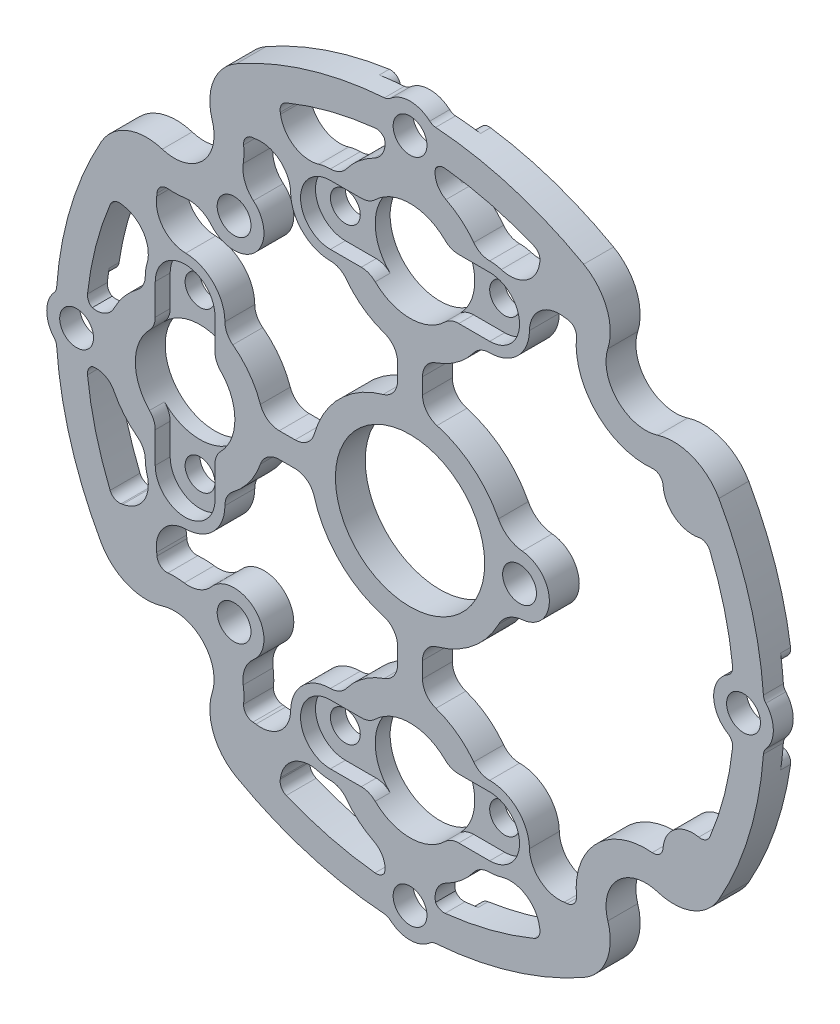
from build123d import *

# Parameters (mm, degrees)
SKETCH_3_R                     = 3
EXTRUDE_2_DEPTH                = 3
EXTRUDE_2_2_DEPTH              = 3
EXTRUDE_2_3_DEPTH              = 3
EXTRUDE_2_4_DEPTH              = 3
EXTRUDE_2_5_DEPTH              = 3
EXTRUDE_2_6_DEPTH              = 3
EXTRUDE_2_7_DEPTH              = 3
EXTRUDE_2_8_DEPTH              = 3
EXTRUDE_2_9_DEPTH              = 3
EXTRUDE_2_10_DEPTH             = 3
EXTRUDE_2_11_DEPTH             = 3
EXTRUDE_2_12_DEPTH             = 3
EXTRUDE_3_DEPTH                = 3
HOLE_WIZARD_M3_1_D             = 3.4
EXTRUDE_4_DEPTH                = 3
FILLET_1_R                     = 1
SKETCH_11_R                    = 5
SKETCH_11_R_2                  = 1.5
EXTRUDE_5_DEPTH                = 3
EXTRUDE_6_DEPTH                = 3
FILLET_2_R                     = 2
PATTERN_CIRCULAR_2_OUTLINE_R   = 1.5
PATTERN_CIRCULAR_2_OUTLINE_R_2 = 5
PATTERN_CIRCULAR_2_DEPTH       = 3
FILLET_3_R                     = 2
CUT_EXTRUDE_1_DEPTH            = 1.5
FILLET_4_R                     = 2
SKETCH_14_R                    = 4
CUT_EXTRUDE_2_DEPTH            = 1
FILLET_5_R                     = 1
SKETCH_16_R                    = 10
SKETCH_16_R_2                  = 7.5
EXTRUDE_7_DEPTH                = 3
SKETCH_17_W                    = 2.5
SKETCH_17_H                    = 7.678432584
SKETCH_17_W_2                  = 7.678432584
SKETCH_17_H_2                  = 2.5
EXTRUDE_8_DEPTH                = 3
FILLET_6_R                     = 2
SKETCH_18_R                    = 3
EXTRUDE_9_DEPTH                = 3
FILLET_7_R                     = 3
SKETCH_21_R                    = 3
EXTRUDE_10_DEPTH               = 3
FILLET_8_R                     = 3
HOLE_WIZARD_M3_2_D             = 3.4


with BuildPart() as part:
    # ｽｹｯﾁ3 → ﾎﾞｽ - 押し出し2 (new body)
    with BuildSketch(Plane.XY):
        with Locations((-15.974774553, 28.414342437)):
            Circle(SKETCH_3_R)
    extrude(amount=EXTRUDE_2_DEPTH)



with BuildPart() as body_2:
    # ｽｹｯﾁ3 → Extrude 2 2 (new body)
    with BuildSketch(Plane.XY):
        with Locations((0, 33.5)):
            Circle(SKETCH_3_R)
    extrude(amount=EXTRUDE_2_2_DEPTH)


with BuildPart() as body_3:
    # ｽｹｯﾁ3 → Extrude 2 3 (new body)
    with BuildSketch(Plane.XY):
        with Locations((15.974774553, 28.414342437)):
            Circle(SKETCH_3_R)
    extrude(amount=EXTRUDE_2_3_DEPTH)


with BuildPart() as body_4:
    # ｽｹｯﾁ3 → Extrude 2 4 (new body)
    with BuildSketch(Plane.XY):
        with Locations((28.414342437, 15.974774553)):
            Circle(SKETCH_3_R)
    extrude(amount=EXTRUDE_2_4_DEPTH)


with BuildPart() as body_5:
    # ｽｹｯﾁ3 → Extrude 2 5 (new body)
    with BuildSketch(Plane.XY):
        with Locations((33.5, 0)):
            Circle(SKETCH_3_R)
    extrude(amount=EXTRUDE_2_5_DEPTH)


with BuildPart() as body_6:
    # ｽｹｯﾁ3 → Extrude 2 6 (new body)
    with BuildSketch(Plane.XY):
        with Locations((28.414342437, -15.974774553)):
            Circle(SKETCH_3_R)
    extrude(amount=EXTRUDE_2_6_DEPTH)


with BuildPart() as body_7:
    # ｽｹｯﾁ3 → Extrude 2 7 (new body)
    with BuildSketch(Plane.XY):
        with Locations((15.974774553, -28.414342437)):
            Circle(SKETCH_3_R)
    extrude(amount=EXTRUDE_2_7_DEPTH)


with BuildPart() as body_8:
    # ｽｹｯﾁ3 → Extrude 2 8 (new body)
    with BuildSketch(Plane.XY):
        with Locations((0, -33.5)):
            Circle(SKETCH_3_R)
    extrude(amount=EXTRUDE_2_8_DEPTH)


with BuildPart() as body_9:
    # ｽｹｯﾁ3 → Extrude 2 9 (new body)
    with BuildSketch(Plane.XY):
        with Locations((-15.974774553, -28.414342437)):
            Circle(SKETCH_3_R)
    extrude(amount=EXTRUDE_2_9_DEPTH)


with BuildPart() as body_10:
    # ｽｹｯﾁ3 → Extrude 2 10 (new body)
    with BuildSketch(Plane.XY):
        with Locations((-28.414342437, -15.974774553)):
            Circle(SKETCH_3_R)
    extrude(amount=EXTRUDE_2_10_DEPTH)


with BuildPart() as body_11:
    # ｽｹｯﾁ3 → Extrude 2 11 (new body)
    with BuildSketch(Plane.XY):
        with Locations((-33.5, 0)):
            Circle(SKETCH_3_R)
    extrude(amount=EXTRUDE_2_11_DEPTH)


with BuildPart() as body_12:
    # ｽｹｯﾁ3 → Extrude 2 12 (new body)
    with BuildSketch(Plane.XY):
        with Locations((-28.414342437, 15.974774553)):
            Circle(SKETCH_3_R)
    extrude(amount=EXTRUDE_2_12_DEPTH)


with BuildPart() as part_1:
    add(part.part)

    add(body_2.part)  # ﾎﾞｽ - 押し出し3 merges body 2

    add(body_3.part)  # ﾎﾞｽ - 押し出し3 merges body 3

    add(body_4.part)  # ﾎﾞｽ - 押し出し3 merges body 4

    add(body_5.part)  # ﾎﾞｽ - 押し出し3 merges body 5

    add(body_6.part)  # ﾎﾞｽ - 押し出し3 merges body 6

    add(body_7.part)  # ﾎﾞｽ - 押し出し3 merges body 7

    add(body_8.part)  # ﾎﾞｽ - 押し出し3 merges body 8

    add(body_9.part)  # ﾎﾞｽ - 押し出し3 merges body 9

    add(body_10.part)  # ﾎﾞｽ - 押し出し3 merges body 10

    add(body_11.part)  # ﾎﾞｽ - 押し出し3 merges body 11

    add(body_12.part)  # ﾎﾞｽ - 押し出し3 merges body 12
    # ｽｹｯﾁ4 → ﾎﾞｽ - 押し出し3 (add, through all)
    with BuildSketch(Plane.XY):
        with BuildLine():
            ThreePointArc((17.44497845, 31.029395114), (0, 35.597059348), (-17.44497845, 31.029395114))
            ThreePointArc((-17.44497845, 31.029395114), (-15.098976916, 31.283659167), (-13.294838524, 29.762653557))
            ThreePointArc((-13.294838524, 29.762653557), (0, 32.597059348), (13.294838524, 29.762653557))
            ThreePointArc((13.294838524, 29.762653557), (15.098976916, 31.283659167), (17.44497845, 31.029395114))
        make_face()
        with BuildLine():
            ThreePointArc((31.029395114, -17.44497845), (35.597059348, 0), (31.029395114, 17.44497845))
            ThreePointArc((31.029395114, 17.44497845), (31.283659167, 15.098976916), (29.762653557, 13.294838524))
            ThreePointArc((29.762653557, 13.294838524), (32.597059348, 0), (29.762653557, -13.294838524))
            ThreePointArc((29.762653557, -13.294838524), (31.283659167, -15.098976916), (31.029395114, -17.44497845))
        make_face()
        with BuildLine():
            ThreePointArc((-17.44497845, -31.029395114), (0, -35.597059348), (17.44497845, -31.029395114))
            ThreePointArc((17.44497845, -31.029395114), (15.098976916, -31.283659167), (13.294838524, -29.762653557))
            ThreePointArc((13.294838524, -29.762653557), (0, -32.597059348), (-13.294838524, -29.762653557))
            ThreePointArc((-13.294838524, -29.762653557), (-15.098976916, -31.283659167), (-17.44497845, -31.029395114))
        make_face()
        with BuildLine():
            ThreePointArc((-31.029395114, 17.44497845), (-35.597059348, 0), (-31.029395114, -17.44497845))
            ThreePointArc((-31.029395114, -17.44497845), (-31.283659167, -15.098976916), (-29.762653557, -13.294838524))
            ThreePointArc((-29.762653557, -13.294838524), (-32.597059348, 0), (-29.762653557, 13.294838524))
            ThreePointArc((-29.762653557, 13.294838524), (-31.283659167, 15.098976916), (-31.029395114, 17.44497845))
        make_face()
    extrude(amount=EXTRUDE_3_DEPTH)

    # M3 すきま穴1 (through all)
    with Locations(Plane.XY.offset(3)):
        with Locations((-33.5, 0), (0, 33.5), (33.5, 0), (0, -33.5)):
            Hole(HOLE_WIZARD_M3_1_D / 2)

    # ｽｹｯﾁ10 → ﾎﾞｽ - 押し出し4 (add, through all)
    with BuildSketch(Plane.XY.offset(3)):
        with BuildLine():
            ThreePointArc((-19.873090279, 24.890522605), (-19.802755968, 22.737141232), (-20.859650045, 20.859650045))
            ThreePointArc((-20.859650045, 20.859650045), (-22.737141232, 19.802755968), (-24.890522605, 19.873090279))
            ThreePointArc((-24.890522605, 19.873090279), (-28.390768746, 19.748229243), (-31.029395114, 17.44497845))
            ThreePointArc((-31.029395114, 17.44497845), (-28.14183504, 18.962372203), (-25.576454012, 16.947599968))
            ThreePointArc((-25.576454012, 16.947599968), (-18.738329701, 18.738329701), (-16.947599968, 25.576454012))
            ThreePointArc((-16.947599968, 25.576454012), (-18.962372203, 28.14183504), (-17.44497845, 31.029395114))
            ThreePointArc((-17.44497845, 31.029395114), (-19.748229243, 28.390768746), (-19.873090279, 24.890522605))
        make_face()
        with BuildLine():
            ThreePointArc((24.890522605, 19.873090279), (22.737141232, 19.802755968), (20.859650045, 20.859650045))
            ThreePointArc((20.859650045, 20.859650045), (19.802755968, 22.737141232), (19.873090279, 24.890522605))
            ThreePointArc((19.873090279, 24.890522605), (19.748229243, 28.390768746), (17.44497845, 31.029395114))
            ThreePointArc((17.44497845, 31.029395114), (18.962372203, 28.14183504), (16.947599968, 25.576454012))
            ThreePointArc((16.947599968, 25.576454012), (18.738329701, 18.738329701), (25.576454012, 16.947599968))
            ThreePointArc((25.576454012, 16.947599968), (28.14183504, 18.962372203), (31.029395114, 17.44497845))
            ThreePointArc((31.029395114, 17.44497845), (28.390768746, 19.748229243), (24.890522605, 19.873090279))
        make_face()
        with BuildLine():
            ThreePointArc((19.873090279, -24.890522605), (19.802755968, -22.737141232), (20.859650045, -20.859650045))
            ThreePointArc((20.859650045, -20.859650045), (22.737141232, -19.802755968), (24.890522605, -19.873090279))
            ThreePointArc((24.890522605, -19.873090279), (28.390768746, -19.748229243), (31.029395114, -17.44497845))
            ThreePointArc((31.029395114, -17.44497845), (28.14183504, -18.962372203), (25.576454012, -16.947599968))
            ThreePointArc((25.576454012, -16.947599968), (18.738329701, -18.738329701), (16.947599968, -25.576454012))
            ThreePointArc((16.947599968, -25.576454012), (18.962372203, -28.14183504), (17.44497845, -31.029395114))
            ThreePointArc((17.44497845, -31.029395114), (19.748229243, -28.390768746), (19.873090279, -24.890522605))
        make_face()
        with BuildLine():
            ThreePointArc((-24.890522605, -19.873090279), (-22.737141232, -19.802755968), (-20.859650045, -20.859650045))
            ThreePointArc((-20.859650045, -20.859650045), (-19.802755968, -22.737141232), (-19.873090279, -24.890522605))
            ThreePointArc((-19.873090279, -24.890522605), (-19.748229243, -28.390768746), (-17.44497845, -31.029395114))
            ThreePointArc((-17.44497845, -31.029395114), (-18.962372203, -28.14183504), (-16.947599968, -25.576454012))
            ThreePointArc((-16.947599968, -25.576454012), (-18.738329701, -18.738329701), (-25.576454012, -16.947599968))
            ThreePointArc((-25.576454012, -16.947599968), (-28.14183504, -18.962372203), (-31.029395114, -17.44497845))
            ThreePointArc((-31.029395114, -17.44497845), (-28.390768746, -19.748229243), (-24.890522605, -19.873090279))
        make_face()
    extrude(amount=-EXTRUDE_4_DEPTH)

    # ﾌｨﾚｯﾄ1
    fillet_1_edges = [part_1.edges().sort_by_distance(p)[0] for p in [
        (16.947599968, -25.576454012, 1.5),
        (25.576454012, -16.947599968, 1.5),
        (13.294838524, -29.762653557, 1.5),
        (-2.819427126, -32.474899674, 1.5),
        (2.819427126, -32.474899674, 1.5),
        (-2.21036752, -35.528367675, 1.5),
        (2.21036752, -35.528367675, 1.5),
        (-13.294838524, -29.762653557, 1.5),
        (-25.576454012, -16.947599968, 1.5),
        (-16.947599968, -25.576454012, 1.5),
        (-2.819427126, 32.474899674, 1.5),
        (2.819427126, 32.474899674, 1.5),
        (2.21036752, 35.528367675, 1.5),
        (-2.21036752, 35.528367675, 1.5),
        (-16.947599968, 25.576454012, 1.5),
        (-25.576454012, 16.947599968, 1.5),
        (-29.762653557, -13.294838524, 1.5),
        (-32.474899674, 2.819427126, 1.5),
        (-32.474899674, -2.819427126, 1.5),
        (-35.528367675, 2.21036752, 1.5),
        (-35.528367675, -2.21036752, 1.5),
        (-29.762653557, 13.294838524, 1.5),
        (13.294838524, 29.762653557, 1.5),
        (25.576454012, 16.947599968, 1.5),
        (16.947599968, 25.576454012, 1.5),
        (-13.294838524, 29.762653557, 1.5),
        (29.762653557, 13.294838524, 1.5),
        (32.474899674, -2.819427126, 1.5),
        (32.474899674, 2.819427126, 1.5),
        (35.528367675, -2.21036752, 1.5),
        (35.528367675, 2.21036752, 1.5),
        (29.762653557, -13.294838524, 1.5),
    ]]
    fillet(fillet_1_edges, radius=FILLET_1_R)

    # ｽｹｯﾁ11 → ﾎﾞｽ - 押し出し5 (add)
    with BuildSketch(Plane.XY.offset(3)):
        with BuildLine():
            ThreePointArc((7, 26.472983346), (0, 30.6), (-7, 26.472983346))
            ThreePointArc((-7, 26.472983346), (-12, 22.6), (-7, 18.727016654))
            ThreePointArc((-7, 18.727016654), (0, 14.6), (7, 18.727016654))
            ThreePointArc((7, 18.727016654), (12, 22.6), (7, 26.472983346))
        make_face()
        with Locations((0, 22.6)):
            Circle(SKETCH_11_R, mode=Mode.SUBTRACT)
        with Locations((8, 22.6)):
            Circle(SKETCH_11_R_2, mode=Mode.SUBTRACT)
        with Locations((-8, 22.6)):
            Circle(SKETCH_11_R_2, mode=Mode.SUBTRACT)
    extrude(amount=-EXTRUDE_5_DEPTH)

    # ｽｹｯﾁ12 → ﾎﾞｽ - 押し出し6 (add)
    with BuildSketch(Plane.XY.offset(3)):
        with BuildLine():
            ThreePointArc((-11.999542968, 22.53953474), (-13.075327897, 24.796079663), (-15.486987374, 25.454264115))
            ThreePointArc((-15.486987374, 25.454264115), (-13.550665526, 26.646944512), (-13.007352228, 28.855255969))
            ThreePointArc((-13.007352228, 28.855255969), (-11.643112099, 26.760463121), (-9.16567423, 26.426382572))
            ThreePointArc((-9.16567423, 26.426382572), (-11.23214537, 24.956530565), (-11.999542968, 22.53953474))
        make_face()
        with BuildLine():
            ThreePointArc((9.16567423, 26.426382572), (11.23214537, 24.956530565), (11.999542968, 22.53953474))
            ThreePointArc((11.999542968, 22.53953474), (13.075327897, 24.796079663), (15.486987374, 25.454264115))
            ThreePointArc((15.486987374, 25.454264115), (13.550665526, 26.646944512), (13.007352228, 28.855255969))
            ThreePointArc((13.007352228, 28.855255969), (11.643112099, 26.760463121), (9.16567423, 26.426382572))
        make_face()
    extrude(amount=-EXTRUDE_6_DEPTH)

    # ﾌｨﾚｯﾄ2
    # the kernel refuses this fillet: 2 mm, written as the material it adds along each edge
    with BuildSketch(Plane(origin=(7, 26.472983346, 3), x_dir=(0.9920296962671665, 0.12600429248272882, 0), z_dir=(0, 0, -1)), Plane(origin=(-7, 18.727016654, 3), x_dir=(-0.9920296962671661, -0.1260042924827324, 0), z_dir=(0, 0, -1))) as fillet_2_piece_1:
        with BuildLine():
            CenterArc((1.260042925, -1.984059393), FILLET_2_R, 97.238756093, 53.130102354)
            Line((-0.47840974, -0.995230625), (-0.513178793, -0.97545405))
            ThreePointArc((-0.513178793, -0.97545405), (-0.258063853, -0.488549754), (-0.037161102, 0.014800422))
            Line((-0.037161102, 0.014800422), (0.005040172, 0.039681188))
            ThreePointArc((0.005040172, 0.039681188), (0.50401717, 0.008118785), (1.002994168, 0.039681188))
            Line((1.002994168, 0.039681188), (1.00803434, 0))
        make_face()
    extrude(amount=3)
    with BuildSketch(Plane(origin=(-0.657491484, 30.57293578, 3), x_dir=(-0.8131085092475036, 0.5821121474332094, 0), z_dir=(0, 0, -1))) as fillet_2_piece_2:
        with BuildLine():
            CenterArc((3.690002082, -1.474292342), FILLET_2_R, 132.511122796, 75.042824498)
            Line((1.916850728, -2.399459503), (1.881387701, -2.417962846))
            ThreePointArc((1.881387701, -2.417962846), (1.043394604, -1.131850569), (-0.025878773, -0.030500641))
            Line((-0.025878773, -0.030500641), (0.015590236, 0.036836728))
            ThreePointArc((0.015590236, 0.036836728), (1.169267719, -0.197245396), (2.311506105, 0.029485847))
            Line((2.311506105, 0.029485847), (2.338535438, 0))
        make_face()
    extrude(amount=3)
    with BuildSketch(Plane(origin=(0.657491484, 30.57293578, 3), x_dir=(0.9623104427147063, -0.2719533265879019, 0), z_dir=(0, 0, -1))) as fillet_2_piece_3:
        with BuildLine():
            CenterArc((3.454999847, -1.962811589), FILLET_2_R, 101.066281051, 75.042824498)
            Line((1.459609696, -1.827098117), (1.419701893, -1.824383848))
            ThreePointArc((1.419701893, -1.824383848), (0.883912708, -0.790437265), (-0.01904981, -0.0351725))
            Line((-0.01904981, -0.0351725), (0.007677777, 0.039256232))
            ThreePointArc((0.007677777, 0.039256232), (1.535555487, -0.108753644), (3.063433197, 0.039256232))
            Line((3.063433197, 0.039256232), (3.071110975, 0))
        make_face()
    extrude(amount=3)
    with BuildSketch(Plane(origin=(7, 18.727016654, 3), x_dir=(-0.5433570423605241, -0.8395017120394833, 0), z_dir=(0, 0, -1)), Plane(origin=(-7, 26.472983346, 3), x_dir=(0.5433570423605201, 0.8395017120394861, 0), z_dir=(0, 0, -1))) as fillet_2_piece_4:
        with BuildLine():
            CenterArc((1.24227708, -1.99523119), FILLET_2_R, 93.957436637, 53.130102354)
            Line((-0.436726344, -0.908517105), (-0.470306413, -0.886782824))
            ThreePointArc((-0.470306413, -0.886782824), (-0.225680438, -0.450741126), (-0.037947332, 0.012649111))
            Line((-0.037947332, 0.012649111), (0.002760616, 0.039904624))
            ThreePointArc((0.002760616, 0.039904624), (0.552123147, 0.02092476), (1.101485678, 0.039904624))
            Line((1.101485678, 0.039904624), (1.104246293, 0))
        make_face()
    extrude(amount=3)

    # 円形ﾊﾟﾀｰﾝ2: read off the stored shape, not the designer's step
    # 円形ﾊﾟﾀｰﾝ2 outline → 円形ﾊﾟﾀｰﾝ2 (add)
    # profile 1 of 2: a face of its own
    with BuildSketch(Plane.XY):
        with BuildLine():
            ThreePointArc((-17.8, 6.4), (-18.388854382, 7.105572809), (-18.6, 8))
            ThreePointArc((-18.6, 8), (-19.750275361, 10.806968022), (-22.53953474, 11.999542968))
            ThreePointArc((-22.53953474, 11.999542968), (-24.796079663, 13.075327897), (-25.454264115, 15.486987374))
            ThreePointArc((-25.454264115, 15.486987374), (-26.646944512, 13.550665526), (-28.855255969, 13.007352228))
            ThreePointArc((-28.855255969, 13.007352228), (-26.760463121, 11.643112099), (-26.426382572, 9.16567423))
            ThreePointArc((-26.426382572, 9.16567423), (-26.55635756, 8.589266371), (-26.6, 8))
            ThreePointArc((-26.6, 8), (-26.811145618, 7.105572809), (-27.4, 6.4))
            ThreePointArc((-27.4, 6.4), (-29.602219157, 3.868969743), (-30.57293578, 0.657491484))
            ThreePointArc((-30.57293578, 0.657491484), (-30.5, 0), (-30.57293578, -0.657491484))
            ThreePointArc((-30.57293578, -0.657491484), (-29.602219157, -3.868969743), (-27.4, -6.4))
            ThreePointArc((-27.4, -6.4), (-26.811145618, -7.105572809), (-26.6, -8))
            ThreePointArc((-26.6, -8), (-26.55635756, -8.589266371), (-26.426382572, -9.16567423))
            ThreePointArc((-26.426382572, -9.16567423), (-26.760463121, -11.643112099), (-28.855255969, -13.007352228))
            ThreePointArc((-28.855255969, -13.007352228), (-26.646944512, -13.550665526), (-25.454264115, -15.486987374))
            ThreePointArc((-25.454264115, -15.486987374), (-24.796079663, -13.075327897), (-22.53953474, -11.999542968))
            ThreePointArc((-22.53953474, -11.999542968), (-19.750275361, -10.806968022), (-18.6, -8))
            ThreePointArc((-18.6, -8), (-18.388854382, -7.105572809), (-17.8, -6.4))
            ThreePointArc((-17.8, -6.4), (-14.6, 0), (-17.8, 6.4))
        make_face()
        with Locations((-22.6, -8)):
            Circle(PATTERN_CIRCULAR_2_OUTLINE_R, mode=Mode.SUBTRACT)
        with Locations((-22.6, 0)):
            Circle(PATTERN_CIRCULAR_2_OUTLINE_R_2, mode=Mode.SUBTRACT)
        with Locations((-22.6, 8)):
            Circle(PATTERN_CIRCULAR_2_OUTLINE_R, mode=Mode.SUBTRACT)
    # profile 2 of 2: a face of its own
    with BuildSketch(Plane.XY):
        with BuildLine():
            ThreePointArc((-6.4, -17.8), (-7.105572809, -18.388854382), (-8, -18.6))
            ThreePointArc((-8, -18.6), (-10.806968022, -19.750275361), (-11.999542968, -22.53953474))
            ThreePointArc((-11.999542968, -22.53953474), (-13.075327897, -24.796079663), (-15.486987374, -25.454264115))
            ThreePointArc((-15.486987374, -25.454264115), (-13.550665526, -26.646944512), (-13.007352228, -28.855255969))
            ThreePointArc((-13.007352228, -28.855255969), (-11.643112099, -26.760463121), (-9.16567423, -26.426382572))
            ThreePointArc((-9.16567423, -26.426382572), (-8.589266371, -26.55635756), (-8, -26.6))
            ThreePointArc((-8, -26.6), (-7.105572809, -26.811145618), (-6.4, -27.4))
            ThreePointArc((-6.4, -27.4), (-3.868969743, -29.602219157), (-0.657491484, -30.57293578))
            ThreePointArc((-0.657491484, -30.57293578), (0, -30.5), (0.657491484, -30.57293578))
            ThreePointArc((0.657491484, -30.57293578), (3.868969743, -29.602219157), (6.4, -27.4))
            ThreePointArc((6.4, -27.4), (7.105572809, -26.811145618), (8, -26.6))
            ThreePointArc((8, -26.6), (8.589266371, -26.55635756), (9.16567423, -26.426382572))
            ThreePointArc((9.16567423, -26.426382572), (11.643112099, -26.760463121), (13.007352228, -28.855255969))
            ThreePointArc((13.007352228, -28.855255969), (13.550665526, -26.646944512), (15.486987374, -25.454264115))
            ThreePointArc((15.486987374, -25.454264115), (13.075327897, -24.796079663), (11.999542968, -22.53953474))
            ThreePointArc((11.999542968, -22.53953474), (10.806968022, -19.750275361), (8, -18.6))
            ThreePointArc((8, -18.6), (7.105572809, -18.388854382), (6.4, -17.8))
            ThreePointArc((6.4, -17.8), (0, -14.6), (-6.4, -17.8))
        make_face()
        with Locations((-8, -22.6)):
            Circle(PATTERN_CIRCULAR_2_OUTLINE_R, mode=Mode.SUBTRACT)
        with Locations((0, -22.6)):
            Circle(PATTERN_CIRCULAR_2_OUTLINE_R_2, mode=Mode.SUBTRACT)
        with Locations((8, -22.6)):
            Circle(PATTERN_CIRCULAR_2_OUTLINE_R, mode=Mode.SUBTRACT)
    extrude(amount=PATTERN_CIRCULAR_2_DEPTH)

    # ﾌｨﾚｯﾄ3
    # the kernel refuses this fillet: 2 mm, written as the material it adds along each edge
    with BuildSketch(Plane(origin=(0.657491484, -30.57293578, 0), x_dir=(0.8131085092173282, -0.582112147475359, 0), z_dir=(0, 0, 1)), Plane(origin=(-30.57293578, -0.657491484, 0), x_dir=(-0.58211214747536, -0.8131085092173275, 0), z_dir=(0, 0, 1))) as fillet_3_piece_1:
        with BuildLine():
            CenterArc((3.690002081, 1.474292342), FILLET_3_R, 152.446052712, 75.042824504)
            Line((1.916850727, 2.399459503), (1.8813877, 2.417962846))
            ThreePointArc((1.8813877, 2.417962846), (1.043394603, 1.131850569), (-0.025878773, 0.030500641))
            Line((-0.025878773, 0.030500641), (0.015590236, -0.036836728))
            ThreePointArc((0.015590236, -0.036836728), (1.169267719, 0.197245396), (2.311506104, -0.029485847))
            Line((2.311506104, -0.029485847), (2.338535437, 0))
        make_face()
    extrude(amount=3)
    with BuildSketch(Plane(origin=(-0.657491484, -30.57293578, 0), x_dir=(-0.8131085092173298, -0.5821121474753568, 0), z_dir=(0, 0, 1)), Plane(origin=(-30.57293578, 0.657491484, 0), x_dir=(-0.5821121474753566, 0.8131085092173298, 0), z_dir=(0, 0, 1))) as fillet_3_piece_2:
        with BuildLine():
            CenterArc((3.690002081, -1.474292342), FILLET_3_R, 132.511122784, 75.042824504)
            Line((1.916850727, -2.399459503), (1.8813877, -2.417962846))
            ThreePointArc((1.8813877, -2.417962846), (1.043394603, -1.131850569), (-0.025878773, -0.030500641))
            Line((-0.025878773, -0.030500641), (0.015590236, 0.036836728))
            ThreePointArc((0.015590236, 0.036836728), (1.169267719, -0.197245396), (2.311506104, 0.029485847))
            Line((2.311506104, 0.029485847), (2.338535437, 0))
        make_face()
    extrude(amount=3)

    # ｽｹｯﾁ13 → ｶｯﾄ - 押し出し1 (cut)
    with BuildSketch(Plane.XY.offset(3)):
        with BuildLine():
            Line((-8, 25.6), (8, 25.6))
            ThreePointArc((8, 25.6), (11, 22.6), (8, 19.6))
            Line((8, 19.6), (-8, 19.6))
            ThreePointArc((-8, 19.6), (-11, 22.6), (-8, 25.6))
        make_face()
        with BuildLine():
            Line((-19.6, 8), (-19.6, -8))
            ThreePointArc((-19.6, -8), (-22.6, -11), (-25.6, -8))
            Line((-25.6, -8), (-25.6, 8))
            ThreePointArc((-25.6, 8), (-22.6, 11), (-19.6, 8))
        make_face()
        with BuildLine():
            Line((-8, -19.6), (8, -19.6))
            ThreePointArc((8, -19.6), (11, -22.6), (8, -25.6))
            Line((8, -25.6), (-8, -25.6))
            ThreePointArc((-8, -25.6), (-11, -22.6), (-8, -19.6))
        make_face()
    extrude(amount=-CUT_EXTRUDE_1_DEPTH, mode=Mode.SUBTRACT)

    # ﾌｨﾚｯﾄ4
    fillet_4_edges = [part_1.edges().sort_by_distance(p)[0] for p in [
        (4, 19.6, 2.25),
        (4, 25.6, 2.25),
        (-4, 19.6, 2.25),
        (-4, 25.6, 2.25),
        (-25.6, 4, 2.25),
        (-19.6, 4, 2.25),
        (-25.6, -4, 2.25),
        (-19.6, -4, 2.25),
        (4, -25.6, 2.25),
        (4, -19.6, 2.25),
        (-4, -25.6, 2.25),
        (-4, -19.6, 2.25),
    ]]
    fillet(fillet_4_edges, radius=FILLET_4_R)

    # ｽｹｯﾁ14 → ｶｯﾄ - 押し出し2 (cut)
    with BuildSketch(Plane(origin=(0, 0, 0), x_dir=(-1, 0, 0), z_dir=(0, 0, -1))):
        with Locations((0, 33.5)):
            Circle(SKETCH_14_R)
        with Locations((33.5, 0)):
            Circle(SKETCH_14_R)
        with Locations((0, -33.5)):
            Circle(SKETCH_14_R)
        with Locations((-33.5, 0)):
            Circle(SKETCH_14_R)
    extrude(amount=-CUT_EXTRUDE_2_DEPTH, mode=Mode.SUBTRACT)

    # ﾌｨﾚｯﾄ5
    fillet_5_edges = [part_1.edges().sort_by_distance(p)[0] for p in [
        (-2.745872013, 30.591359959, 0.5),
        (3.506942689, 35.423890063, 0.5),
        (3.837193464, 32.370422062, 0.5),
        (-3.506942689, 35.423890063, 0.5),
        (-3.837193464, 32.370422062, 0.5),
        (2.745872013, 30.591359959, 0.5),
        (2.745872013, -30.591359959, 0.5),
        (-30.591359959, -2.745872013, 0.5),
        (32.370422062, 3.837193464, 0.5),
        (-35.423890063, 3.506942689, 0.5),
        (-32.370422062, 3.837193464, 0.5),
        (-35.423890063, -3.506942689, 0.5),
        (-32.370422062, -3.837193464, 0.5),
        (-30.591359959, 2.745872013, 0.5),
        (-3.506942689, -35.423890063, 0.5),
        (-3.837193464, -32.370422062, 0.5),
        (3.506942689, -35.423890063, 0.5),
        (3.837193464, -32.370422062, 0.5),
        (-2.745872013, -30.591359959, 0.5),
        (35.423890063, -3.506942689, 0.5),
        (32.370422062, -3.837193464, 0.5),
        (35.423890063, 3.506942689, 0.5),
    ]]
    fillet(fillet_5_edges, radius=FILLET_5_R)



with BuildPart() as body_2_2:
    # ｽｹｯﾁ16 → ﾎﾞｽ - 押し出し7 (new body)
    with BuildSketch(Plane(origin=(0, 0, 0), x_dir=(-1, 0, 0), z_dir=(0, 0, -1))):
        Circle(SKETCH_16_R)
        Circle(SKETCH_16_R_2, mode=Mode.SUBTRACT)
    extrude(amount=-EXTRUDE_7_DEPTH)


with BuildPart() as part_2:
    add(part_1.part)

    add(body_2_2.part)  # ﾎﾞｽ - 押し出し8 merges body 2 2
    # ｽｹｯﾁ17 → ﾎﾞｽ - 押し出し8 (add)
    with BuildSketch(Plane(origin=(0, 0, 0), x_dir=(-1, 0, 0), z_dir=(0, 0, -1))):
        with Locations((0, 13.760783708)):
            Rectangle(SKETCH_17_W, SKETCH_17_H)
        with Locations((13.760783708, 0)):
            Rectangle(SKETCH_17_W_2, SKETCH_17_H_2)
        with Locations((0, -13.760783708)):
            Rectangle(SKETCH_17_W, SKETCH_17_H)
    extrude(amount=-EXTRUDE_8_DEPTH)

    # ﾌｨﾚｯﾄ6
    fillet_6_edges = [part_2.edges().sort_by_distance(p)[0] for p in [
        (1.25, 14.698259685, 1.5),
        (-1.25, 14.698259685, 1.5),
        (-1.25, 9.921567416, 1.5),
        (1.25, 9.921567416, 1.5),
        (-9.921567416, -1.25, 1.5),
        (-14.698259685, -1.25, 1.5),
        (-14.698259685, 1.25, 1.5),
        (-9.921567416, 1.25, 1.5),
        (-1.25, -14.698259685, 1.5),
        (1.25, -14.698259685, 1.5),
        (1.25, -9.921567416, 1.5),
        (-1.25, -9.921567416, 1.5),
    ]]
    fillet(fillet_6_edges, radius=FILLET_6_R)

    # ｽｹｯﾁ18 → ﾎﾞｽ - 押し出し9 (add)
    with BuildSketch(Plane.XY.offset(3)):
        with Locations((-17.67766953, 17.67766953)):
            Circle(SKETCH_18_R)
        with Locations((-17.67766953, -17.67766953)):
            Circle(SKETCH_18_R)
    extrude(amount=-EXTRUDE_9_DEPTH)

    # ﾌｨﾚｯﾄ7
    fillet_7_edges = [part_2.edges().sort_by_distance(p)[0] for p in [
        (-20.662438029, 17.375747347, 1.5),
        (-17.375747347, 20.662438029, 1.5),
        (-17.375747347, -20.662438029, 1.5),
        (-20.662438029, -17.375747347, 1.5),
    ]]
    fillet(fillet_7_edges, radius=FILLET_7_R)

    # ｽｹｯﾁ21 → ﾎﾞｽ - 押し出し10 (add)
    with BuildSketch(Plane(origin=(0, 0, 0), x_dir=(-1, 0, 0), z_dir=(0, 0, -1))):
        with Locations((-11, 0)):
            Circle(SKETCH_21_R)
    extrude(amount=-EXTRUDE_10_DEPTH)

    # ﾌｨﾚｯﾄ8
    fillet_8_edges = [part_2.edges().sort_by_distance(p)[0] for p in [
        (9.636363636, -2.672170628, 1.5),
        (9.636363636, 2.672170628, 1.5),
    ]]
    fillet(fillet_8_edges, radius=FILLET_8_R)

    # M3 すきま穴2 (through all)
    with Locations(Plane.XY.offset(3)):
        with Locations((-17.67766953, 17.67766953), (-17.67766953, -17.67766953), (11, 0)):
            Hole(HOLE_WIZARD_M3_2_D / 2)


solid = part_2.part
